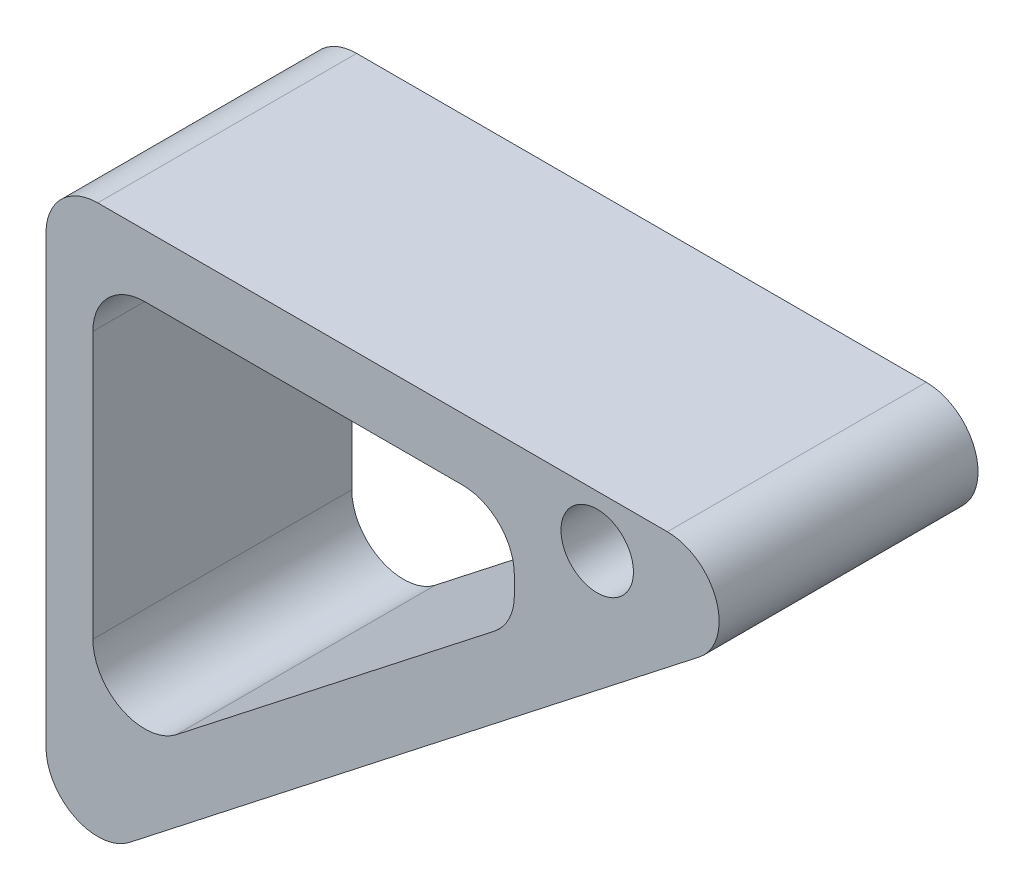
from build123d import *

# Parameters (mm, degrees)
BOSS_EXTRUDE1_DEPTH = 25
SKETCH3_R           = 3.5
CUT_EXTRUDE1_DEPTH  = 56.184076271


with BuildPart() as part:
    # Sketch2 → Boss-Extrude1 (new body)
    with BuildSketch(Plane.XY):
        with BuildLine():
            ThreePointArc((24.100290936, 14.04605167), (25.748004826, 19.613709748), (21.020681104, 22.985087501))
            Line((21.020681104, 22.985087501), (-33.979318896, 22.985087501))
            ThreePointArc((-33.979318896, 22.985087501), (-37.514852802, 21.520621407), (-38.979318896, 17.985087501))
            Line((-38.979318896, 17.985087501), (-38.979318896, -25.014912499))
            ThreePointArc((-38.979318896, -25.014912499), (-36.170431723, -29.509244994), (-30.899709064, -28.95394833))
            Line((-30.899709064, -28.95394833), (24.100290936, 14.04605167))
        make_face()
        with BuildLine():
            Line((-34.453101677, -13.737840514), (-34.453101677, 11.998107897))
            ThreePointArc((-34.453101677, 11.998107897), (-32.988635583, 15.533641803), (-29.453101677, 16.998107897))
            Line((-29.453101677, 16.998107897), (1.245861273, 16.998107897))
            ThreePointArc((1.245861273, 16.998107897), (4.781395179, 15.533641803), (6.245861273, 11.998107897))
            Line((6.245861273, 11.998107897), (6.245861273, 10.263166883))
            ThreePointArc((6.245861273, 10.263166883), (5.740193768, 8.072054056), (4.325471105, 6.324131052))
            Line((4.325471105, 6.324131052), (-26.373491845, -17.676876345))
            ThreePointArc((-26.373491845, -17.676876345), (-31.644214504, -18.232173009), (-34.453101677, -13.737840514))
        make_face(mode=Mode.SUBTRACT)
    extrude(amount=BOSS_EXTRUDE1_DEPTH)

    # Sketch3 → Cut-Extrude1 (cut, through all)
    with BuildSketch(Plane.XY.offset(25)):
        with Locations((14.245861273, 17.985087501)):
            Circle(SKETCH3_R)
    extrude(amount=-CUT_EXTRUDE1_DEPTH, mode=Mode.SUBTRACT)


solid = part.part
